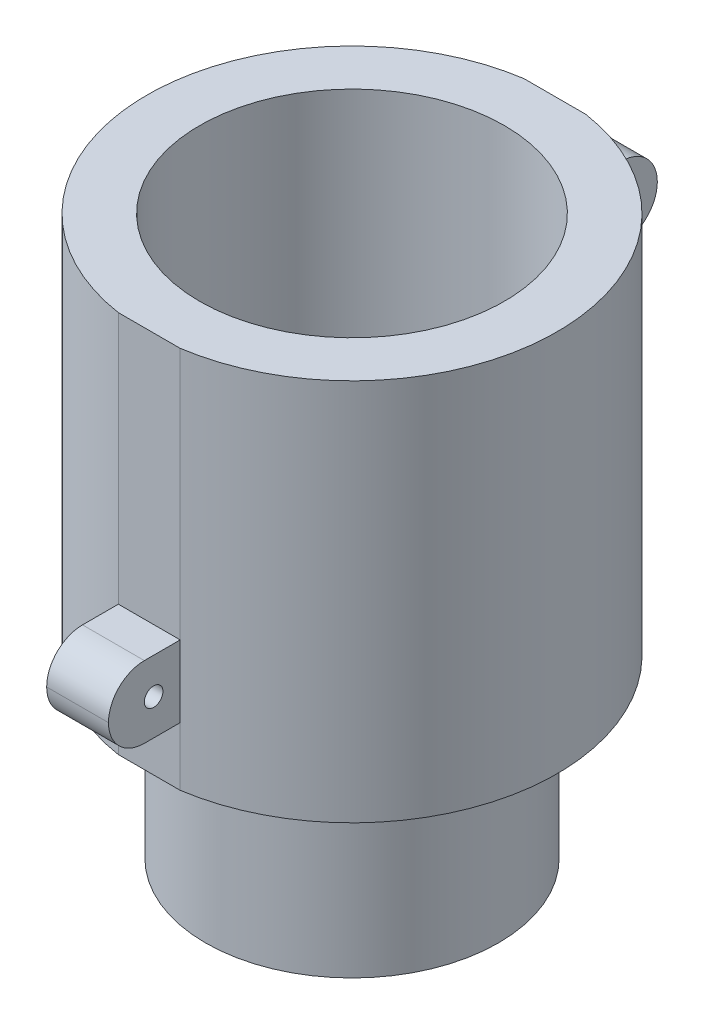
from build123d import *

# Parameters (mm, degrees)
SKETCH2_R           = 17.5
BOSS_EXTRUDE1_DEPTH = 32.665
SKETCH3_R           = 12.5
BOSS_EXTRUDE2_DEPTH = 15
SKETCH4_R           = 13
CUT_EXTRUDE1_DEPTH  = 25
SKETCH8_W           = 35
SKETCH8_H           = 1.857450862
CUT_EXTRUDE4_DEPTH  = 35
SKETCH11_W          = 35
SKETCH11_H          = 2.234434129
CUT_EXTRUDE8_DEPTH  = 35
SKETCH13_W          = 5.276362384
SKETCH13_H          = 6.1175
BOSS_EXTRUDE3_DEPTH = 6.1175
SKETCH14_W          = 5.276362384
SKETCH14_H          = 6.1175
BOSS_EXTRUDE4_DEPTH = 6.1175
SKETCH18_R          = 0.79375
CUT_EXTRUDE11_DEPTH = 6.1175
SKETCH15_R          = 0.79375
CUT_EXTRUDE12_DEPTH = 6.1175
FILLET8_R           = 3.06
FILLET9_R           = 3.06
FILLET10_R          = 3.06
FILLET11_R          = 3.06


with BuildPart() as part:
    # Sketch2 → Boss-Extrude1 (new body)
    with BuildSketch(Plane(origin=(0, 0, 0), x_dir=(1, 0, 0), z_dir=(0, 1, 0))):
        with Locations(Location((0, 0, 0), (0, 0, 270))):
            Circle(SKETCH2_R)
    extrude(amount=BOSS_EXTRUDE1_DEPTH)

    # Sketch3 → Boss-Extrude2 (add)
    with BuildSketch(Plane.XZ):
        with Locations(Location((0, 0, 0), (0, 0, 270))):
            Circle(SKETCH3_R)
    extrude(amount=BOSS_EXTRUDE2_DEPTH)

    # Sketch4 → Cut-Extrude1 (cut)
    with BuildSketch(Plane(origin=(0, 32.665, 0), x_dir=(1, 0, 0), z_dir=(0, 1, 0))):
        with Locations(Location((0, 0, 0), (0, 0, 270))):
            Circle(SKETCH4_R)
    extrude(amount=-CUT_EXTRUDE1_DEPTH, mode=Mode.SUBTRACT)

    # Sketch8 → Cut-Extrude4 (cut)
    with BuildSketch(Plane(origin=(0, 32.665, 0), x_dir=(1, 0, 0), z_dir=(0, 1, 0))):
        with Locations((0, -18.228725431)):
            Rectangle(SKETCH8_W, SKETCH8_H)
    extrude(amount=-CUT_EXTRUDE4_DEPTH, mode=Mode.SUBTRACT)

    # Sketch11 → Cut-Extrude8 (cut)
    with BuildSketch(Plane(origin=(0, 32.665, 0), x_dir=(1, 0, 0), z_dir=(0, 1, 0))):
        with Locations((0, 18.417217065)):
            Rectangle(SKETCH11_W, SKETCH11_H)
    extrude(amount=-CUT_EXTRUDE8_DEPTH, mode=Mode.SUBTRACT)

    # Sketch13 → Boss-Extrude3 (add)
    with BuildSketch(Plane(origin=(0, 0, -17.3), x_dir=(-1, 0, 0), z_dir=(0, 0, -1))):
        with Locations((0, 24.60625)):
            Rectangle(SKETCH13_W, SKETCH13_H)
    extrude(amount=BOSS_EXTRUDE3_DEPTH)

    # Sketch14 → Boss-Extrude4 (add)
    with BuildSketch(Plane.XY.offset(17.3)):
        with Locations((0, 8.05875)):
            Rectangle(SKETCH14_W, SKETCH14_H)
    extrude(amount=BOSS_EXTRUDE4_DEPTH)

    # Sketch18 → Cut-Extrude11 (cut)
    with BuildSketch(Plane(origin=(2.638181192, 0, 0), x_dir=(0, 0, -1), z_dir=(1, 0, 0))):
        with Locations((-19.565, 8.0575)):
            Circle(SKETCH18_R)
    extrude(amount=-CUT_EXTRUDE11_DEPTH, mode=Mode.SUBTRACT)

    # Sketch15 → Cut-Extrude12 (cut)
    with BuildSketch(Plane(origin=(2.638181192, 0, 0), x_dir=(0, 0, -1), z_dir=(1, 0, 0))):
        with Locations(Location((19.565, 24.60625, 0), (0, 0, 90))):
            Circle(SKETCH15_R)
    extrude(amount=-CUT_EXTRUDE12_DEPTH, mode=Mode.SUBTRACT)

    # Fillet8
    fillet8_edges = [part.edges().sort_by_distance(p)[0] for p in [
        (0, 27.665, -23.4175),
    ]]
    fillet(fillet8_edges, radius=FILLET8_R)

    # Fillet9
    # the kernel refuses this fillet: 3.06 mm, written as the material it takes off along each edge
    with BuildSketch(Plane(origin=(-10.288181192, 21.5475, -23.4175), x_dir=(0, 1, 0), z_dir=(1, 0, 0))) as fillet9_piece_1:
        with BuildLine():
            CenterArc((FILLET9_R, FILLET9_R), FILLET9_R, 180, 90)
            Line((0, FILLET9_R), (0, 0))
            Line((0, 0), (FILLET9_R, 0))
        make_face()
    extrude(amount=20.576362383, mode=Mode.SUBTRACT)

    # Fillet10
    fillet10_edges = [part.edges().sort_by_distance(p)[0] for p in [
        (0, 11.1175, 23.4175),
    ]]
    fillet(fillet10_edges, radius=FILLET10_R)

    # Fillet11
    # the kernel refuses this fillet: 3.06 mm, written as the material it takes off along each edge
    with BuildSketch(Plane(origin=(10.288181192, 5, 23.4175), x_dir=(0, 1, 0), z_dir=(-1, 0, 0))) as fillet11_piece_1:
        with BuildLine():
            CenterArc((FILLET11_R, FILLET11_R), FILLET11_R, 180, 90)
            Line((0, FILLET11_R), (0, 0))
            Line((0, 0), (FILLET11_R, 0))
        make_face()
    extrude(amount=20.576362383, mode=Mode.SUBTRACT)


solid = part.part
